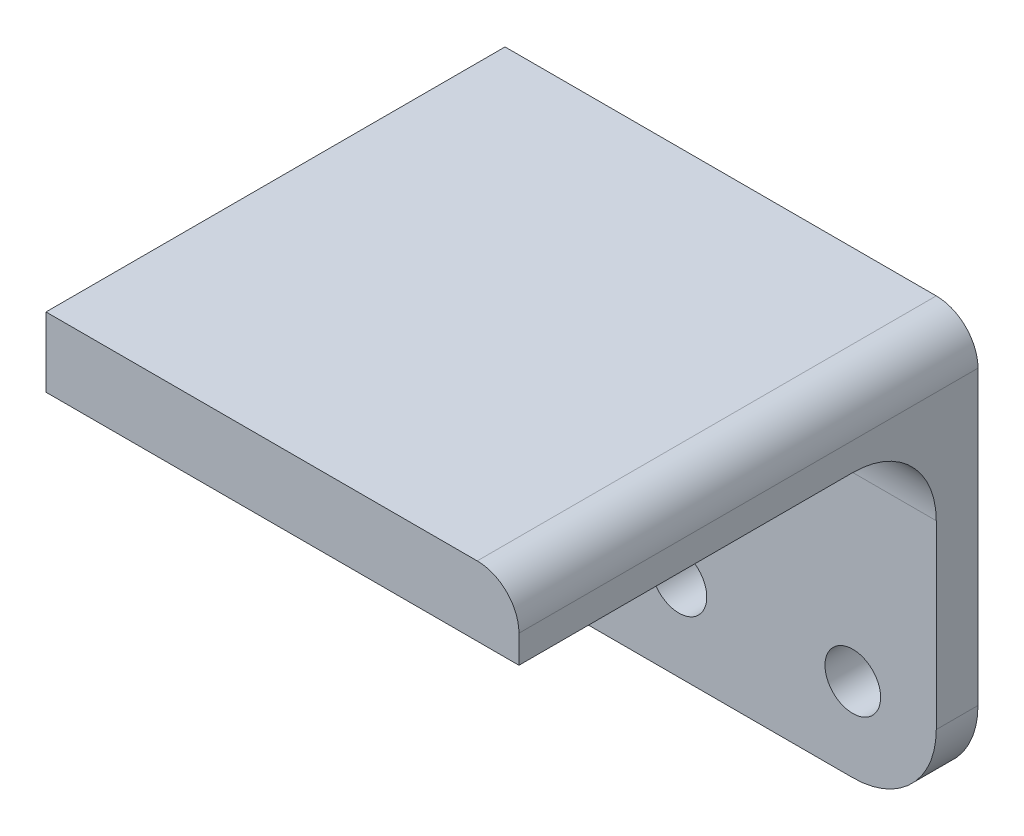
from build123d import *

# Parameters (mm, degrees)
ESQUISSE1_R                  = 2
BOSS_EXTRU_1_DEPTH           = 3
BOSS_EXTRU_2_DEPTH           = 30
CONG_1_START                 = -11
CONG_1_DEPTH                 = 34
CONG_1_2_DEPTH               = 25
CONG_1_START_2               = 16.9999999
CONG_1_3_DEPTH               = 6.0000001
CONG_1_START_3               = 3
CONG_1_4_DEPTH               = 2
ENL_V_MAT_EXTRU_1_DEPTH      = 74.008561265
ENL_V_MAT_EXTRU_1_DEPTH_BACK = 74.008561265
ESQUISSE3_W                  = 37.381504973
ESQUISSE3_H                  = 48.316758503


with BuildPart() as part:
    # Esquisse1 → Boss.-Extru.1 (new body)
    with BuildSketch(Plane.XY):
        with BuildLine():
            Line((-5, 1.5), (23, 1.5))
            Line((23, 1.5), (23, 31.5))
            Line((23, 31.5), (-8, 31.5))
            ThreePointArc((-8, 31.5), (-10.121320344, 30.621320344), (-11, 28.5))
            Line((-11, 28.5), (-11, 7.5))
            ThreePointArc((-11, 7.5), (-9.242640687, 3.257359313), (-5, 1.5))
        make_face()
        with Locations((-5, 7.5)):
            Circle(ESQUISSE1_R, mode=Mode.SUBTRACT)
        with Locations((7.5, 7.5)):
            Circle(ESQUISSE1_R, mode=Mode.SUBTRACT)
        with BuildLine():
            Line((14, 23.5), (17, 23.5))
            ThreePointArc((17, 23.5), (19, 21.5), (17, 19.5))
            Line((17, 19.5), (14, 19.5))
            ThreePointArc((14, 19.5), (12, 21.5), (14, 23.5))
        make_face(mode=Mode.SUBTRACT)
    boss_extru_1 = extrude(amount=BOSS_EXTRU_1_DEPTH)

    # Esquisse2 → Boss.-Extru.2 (add)
    with BuildSketch(Plane.XY.offset(3)):
        with BuildLine():
            Line((23, 31.5), (-8, 31.5))
            ThreePointArc((-8, 31.5), (-10.121320344, 30.621320344), (-11, 28.5))
            Line((-11, 28.5), (-11, 26.5))
            Line((-11, 26.5), (23, 26.5))
            Line((23, 26.5), (23, 31.5))
        make_face()
    boss_extru_2 = extrude(amount=BOSS_EXTRU_2_DEPTH)

    # Congé1: read off the stored shape, not the designer's step
    # Congé1 outline → Congé1 (add)
    with BuildSketch(Plane.YZ.offset(CONG_1_START)):
        with BuildLine():
            ThreePointArc((26.5, 9), (25.696152423, 6), (23.5, 3.803847577))
            Line((23.5, 3.803847577), (23.5, 3))
            Line((23.5, 3), (26.5, 3))
            Line((26.5, 3), (26.5, 9))
        make_face()
    cong_1 = extrude(amount=CONG_1_DEPTH)

    # Cong_1 2 outline → Cong_1 2 (add)
    with BuildSketch(Plane.YZ.offset(CONG_1_START)):
        with BuildLine():
            Line((23.5, 3), (23.5, 3.803847577))
            ThreePointArc((23.5, 3.803847577), (22.052914271, 3.204445042), (20.5, 3))
            Line((20.5, 3), (23.5, 3))
        make_face()
    cong_1_2 = extrude(amount=CONG_1_2_DEPTH)

    # Cong_1 3 outline → Cong_1 3 (add)
    with BuildSketch(Plane.YZ.offset(CONG_1_START_2)):
        with BuildLine():
            Line((23.5, 3), (23.5, 3.803847577))
            ThreePointArc((23.5, 3.803847577), (22.052914271, 3.204445042), (20.5, 3))
            Line((20.5, 3), (23.5, 3))
        make_face()
    cong_1_3 = extrude(amount=CONG_1_3_DEPTH)

    # Cong_1 4 outline → Cong_1 4 (cut)
    with BuildSketch(Plane.XY.offset(CONG_1_START_3)):
        with BuildLine():
            Line((17, 23.5), (17, 19.5))
            ThreePointArc((17, 19.5), (19, 21.5), (17, 23.5))
        make_face()
        with BuildLine():
            ThreePointArc((14, 23.5), (12, 21.5), (14, 19.5))
            Line((14, 19.5), (14, 23.5))
        make_face()
    cong_1_4 = extrude(amount=CONG_1_4_DEPTH, mode=Mode.SUBTRACT)

    # Symétrie1: Boss.-Extru.1, Boss.-Extru.2, Congé1, Cong_1 2, Cong_1 3, Cong_1 4 across plane
    add(boss_extru_1.mirror(Plane(origin=(23, 1.5, 3), x_dir=(0, 0, 1), z_dir=(-1, 0, 0))))
    add(boss_extru_2.mirror(Plane(origin=(23, 1.5, 3), x_dir=(0, 0, 1), z_dir=(-1, 0, 0))))
    add(cong_1.mirror(Plane(origin=(23, 1.5, 3), x_dir=(0, 0, 1), z_dir=(-1, 0, 0))))
    add(cong_1_2.mirror(Plane(origin=(23, 1.5, 3), x_dir=(0, 0, 1), z_dir=(-1, 0, 0))))
    add(cong_1_3.mirror(Plane(origin=(23, 1.5, 3), x_dir=(0, 0, 1), z_dir=(-1, 0, 0))))
    add(cong_1_4.mirror(Plane(origin=(23, 1.5, 3), x_dir=(0, 0, 1), z_dir=(-1, 0, 0))), mode=Mode.SUBTRACT)

    # Esquisse3 → Enlèv. mat.-Extru.1 (cut, two sides: drawn at the far end of the back side and taken through both)
    with BuildSketch(Plane.XY.offset(33).offset(-ENL_V_MAT_EXTRU_1_DEPTH_BACK)):
        with Locations((4.309247513, 15.68567261)):
            Rectangle(ESQUISSE3_W, ESQUISSE3_H)
    extrude(amount=ENL_V_MAT_EXTRU_1_DEPTH + ENL_V_MAT_EXTRU_1_DEPTH_BACK, mode=Mode.SUBTRACT)


solid = part.part
